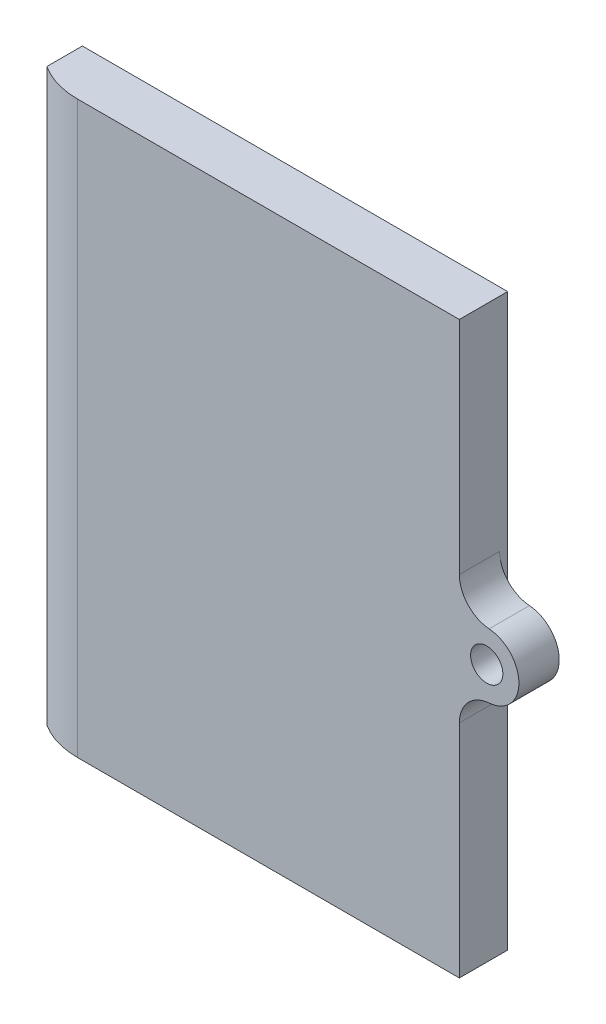
from build123d import *

# Parameters (mm, degrees)
BOSS_EXTRUDE1_DEPTH = 35.4
SKETCH2_W           = 28.62824493
SKETCH2_H           = 44.507069041
CUT_EXTRUDE1_DEPTH  = 36
SKETCH3_W           = 27
SKETCH3_H           = 2
CUT_EXTRUDE2_DEPTH  = 39.528041736
SKETCH4_W           = 4.666859097
SKETCH4_H           = 39.875061907
SKETCH4_W_2         = 6.439084071
SKETCH4_H_2         = 41.174693554
CUT_EXTRUDE3_DEPTH  = 39.563713514
SKETCH5_R           = 1
BOSS_EXTRUDE2_DEPTH = 2.5
FILLET1_R           = 2


with BuildPart() as part:
    # Sketch1 → Boss-Extrude1 (new body)
    with BuildSketch(Plane(origin=(0, 0, 0), x_dir=(1, 0, 0), z_dir=(0, 1, 0))):
        with BuildLine():
            Line((-17, 2.5), (-12, 2.5))
            Line((-12, 2.5), (12, 2.5))
            Line((12, 2.5), (12, -2.5))
            Line((12, -2.5), (-12, -2.5))
            ThreePointArc((-12, -2.5), (-15.535533906, -1.035533906), (-17, 2.5))
        make_face()
    extrude(amount=BOSS_EXTRUDE1_DEPTH)

    # Sketch2 → Cut-Extrude1 (cut)
    with BuildSketch(Plane(origin=(0, 0, -2.5), x_dir=(-1, 0, 0), z_dir=(0, 0, -1))):
        with Locations((29.314122465, 17.150131431)):
            Rectangle(SKETCH2_W, SKETCH2_H)
    extrude(amount=-CUT_EXTRUDE1_DEPTH, mode=Mode.SUBTRACT)

    # Sketch3 → Cut-Extrude2 (cut, through all)
    with BuildSketch(Plane(origin=(0, 35.4, 0), x_dir=(1, 0, 0), z_dir=(0, 1, 0))):
        with Locations((-1.5, 1.5)):
            Rectangle(SKETCH3_W, SKETCH3_H)
    extrude(amount=-CUT_EXTRUDE2_DEPTH, mode=Mode.SUBTRACT)

    # Sketch4 → Cut-Extrude3 (cut, through all)
    with BuildSketch(Plane(origin=(0, 0, -0.5), x_dir=(-1, 0, 0), z_dir=(0, 0, -1))):
        with Locations((-14.033429549, 18.67919463)):
            Rectangle(SKETCH4_W, SKETCH4_H)
        with Locations((17.919542036, 18.501972132)):
            Rectangle(SKETCH4_W_2, SKETCH4_H_2)
    extrude(amount=-CUT_EXTRUDE3_DEPTH, mode=Mode.SUBTRACT)

    # Sketch5 → Boss-Extrude2 (add)
    with BuildSketch(Plane.XY.offset(2.5)):
        with BuildLine():
            Line((13.4, 19.7), (11.7, 19.7))
            Line((11.7, 19.7), (11.7, 15.7))
            Line((11.7, 15.7), (13.4, 15.7))
            ThreePointArc((13.4, 15.7), (15.4, 17.7), (13.4, 19.7))
        make_face()
        with Locations((13.4, 17.7)):
            Circle(SKETCH5_R, mode=Mode.SUBTRACT)
    extrude(amount=-BOSS_EXTRUDE2_DEPTH)

    # Fillet1
    # the kernel refuses this fillet: 2 mm, written as the material it adds along each edge
    with BuildSketch(Plane(origin=(11.7, 15.7, 2.5), x_dir=(0, -1, 0), z_dir=(0, 0, -1))) as fillet1_piece_1:
        with BuildLine():
            CenterArc((1.988734135, -2), FILLET1_R, 90, 85.698777695)
            Line((-0.005632932, -1.85), (-0.205069639, -1.835))
            ThreePointArc((-0.205069639, -1.835), (-0.2, -1.7), (-0.2, 0))
            Line((-0.2, 0), (0, 0.2))
            Line((0, 0.2), (1.988734135, 0.2))
            Line((1.988734135, 0.2), (1.988734135, 0))
        make_face()
    extrude(amount=2.5)
    with BuildSketch(Plane(origin=(11.7, 19.7, 2.5), x_dir=(0, 1, 0), z_dir=(0, 0, -1))) as fillet1_piece_2:
        with BuildLine():
            CenterArc((1.988734135, 2), FILLET1_R, 184.301222305, 85.698777695)
            Line((-0.005632932, 1.85), (-0.205069639, 1.835))
            ThreePointArc((-0.205069639, 1.835), (-0.2, 1.7), (-0.2, 0))
            Line((-0.2, 0), (0, -0.2))
            Line((0, -0.2), (1.988734135, -0.2))
            Line((1.988734135, -0.2), (1.988734135, 0))
        make_face()
    extrude(amount=2.5)


solid = part.part
